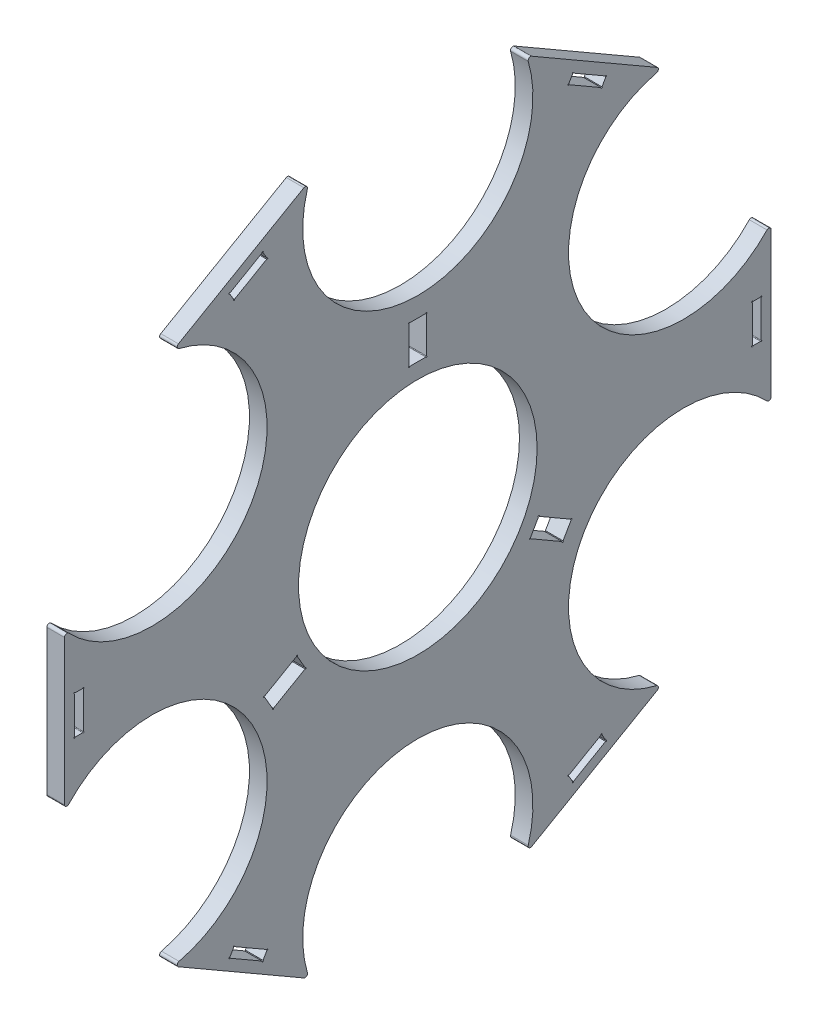
from build123d import *

# Parameters (mm, degrees)
SKETCH2_R           = 39.487475
BOSS_EXTRUDE1_DEPTH = 5.842
FILLET1_R           = 0.79375
SKETCH4_W           = 5.742
SKETCH4_H           = 12.5
CUT_EXTRUDE3_DEPTH  = 163.986308211
SKETCH5_R           = 0.1984375
CUT_EXTRUDE4_DEPTH  = 163.986308211
SKETCH6_W           = 2.975
SKETCH6_H           = 12.7
CUT_EXTRUDE5_DEPTH  = 163.986308211
SKETCH7_R           = 0.1984375
CUT_EXTRUDE6_DEPTH  = 163.986308211


with BuildPart() as part:
    # Sketch2 → Boss-Extrude1 (new body)
    with BuildSketch(Plane(origin=(0, 0, 0), x_dir=(0, 0, -1), z_dir=(1, 0, 0))):
        with BuildLine():
            ThreePointArc((116.947215895, 26.041480267), (54.99261314, 31.75), (81.02619141, 88.258519733))
            Line((81.02619141, 88.258519733), (35.921024484, 114.3))
            ThreePointArc((35.921024484, 114.3), (0, 63.5), (-35.921024484, 114.3))
            Line((-35.921024484, 114.3), (-81.02619141, 88.258519733))
            ThreePointArc((-81.02619141, 88.258519733), (-54.99261314, 31.75), (-116.947215895, 26.041480267))
            Line((-116.947215895, 26.041480267), (-116.947215895, -26.041480267))
            ThreePointArc((-116.947215895, -26.041480267), (-54.99261314, -31.75), (-81.02619141, -88.258519733))
            Line((-81.02619141, -88.258519733), (-35.921024484, -114.3))
            ThreePointArc((-35.921024484, -114.3), (0, -63.5), (35.921024484, -114.3))
            Line((35.921024484, -114.3), (81.02619141, -88.258519733))
            ThreePointArc((81.02619141, -88.258519733), (54.99261314, -31.75), (116.947215895, -26.041480267))
            Line((116.947215895, -26.041480267), (116.947215895, 26.041480267))
        make_face()
        Circle(SKETCH2_R, mode=Mode.SUBTRACT)
    extrude(amount=BOSS_EXTRUDE1_DEPTH)

    # Fillet1
    fillet1_edges = [part.edges().sort_by_distance(p)[0] for p in [
        (2.921, -114.3, 35.921024484),
        (2.921, -114.3, -35.921024484),
        (2.921, -88.258519733, -81.02619141),
        (2.921, -26.041480267, -116.947215895),
        (2.921, 88.258519733, -81.02619141),
        (2.921, 26.041480267, -116.947215895),
        (2.921, -88.258519733, 81.02619141),
        (2.921, -26.041480267, 116.947215895),
        (2.921, 26.041480267, 116.947215895),
        (2.921, 88.258519733, 81.02619141),
        (2.921, 114.3, -35.921024484),
        (2.921, 114.3, 35.921024484),
    ]]
    fillet(fillet1_edges, radius=FILLET1_R)

    # Sketch4 → Cut-Extrude3 (cut, through all)
    with BuildSketch(Plane(origin=(5.842, 0, 0), x_dir=(0, 0, -1), z_dir=(1, 0, 0))):
        Polygon((47.971249286, -31.011358934), (50.842249286, -26.038641066), (40.016931739, -19.788641066), (37.145931739, -24.761358934), align=None)
        with Locations((0, 50.8)):
            Rectangle(SKETCH4_W, SKETCH4_H)
        Polygon((-50.842249286, -26.038641066), (-47.971249286, -31.011358934), (-37.145931739, -24.761358934), (-40.016931739, -19.788641066), align=None)
    extrude(amount=-CUT_EXTRUDE3_DEPTH, mode=Mode.SUBTRACT)

    # Sketch5 → Cut-Extrude4 (cut, through all)
    with BuildSketch(Plane(origin=(5.842, 0, 0), x_dir=(0, 0, -1), z_dir=(1, 0, 0))):
        with Locations((2.871, 57.05)):
            Circle(SKETCH5_R)
        with Locations((-2.871, 57.05)):
            Circle(SKETCH5_R)
        with Locations((-2.871, 44.55)):
            Circle(SKETCH5_R)
        with Locations((2.871, 44.55)):
            Circle(SKETCH5_R)
        with Locations((47.971249286, -31.011358934)):
            Circle(SKETCH5_R)
        with Locations((50.842249286, -26.038641066)):
            Circle(SKETCH5_R)
        with Locations((40.016931739, -19.788641066)):
            Circle(SKETCH5_R)
        with Locations((37.145931739, -24.761358934)):
            Circle(SKETCH5_R)
        with Locations((-50.842249286, -26.038641066)):
            Circle(SKETCH5_R)
        with Locations((-47.971249286, -31.011358934)):
            Circle(SKETCH5_R)
        with Locations((-37.145931739, -24.761358934)):
            Circle(SKETCH5_R)
        with Locations((-40.016931739, -19.788641066)):
            Circle(SKETCH5_R)
    extrude(amount=-CUT_EXTRUDE4_DEPTH, mode=Mode.SUBTRACT)

    # Sketch6 → Cut-Extrude5 (cut, through all)
    with BuildSketch(Plane(origin=(5.842, 0, 0), x_dir=(0, 0, -1), z_dir=(1, 0, 0))):
        Polygon((-49.849346633, 99.041601093), (-60.847869261, 92.691601093), (-62.335369261, 95.268026669), (-51.336846633, 101.618026669), align=None)
        Polygon((60.847869261, 92.691601093), (49.849346633, 99.041601093), (51.336846633, 101.618026669), (62.335369261, 95.268026669), align=None)
        with Locations((112.184715895, 0)):
            Rectangle(SKETCH6_W, SKETCH6_H)
        Polygon((49.849346633, -99.041601093), (60.847869261, -92.691601093), (62.335369261, -95.268026669), (51.336846633, -101.618026669), align=None)
        Polygon((-60.847869261, -92.691601093), (-49.849346633, -99.041601093), (-51.336846633, -101.618026669), (-62.335369261, -95.268026669), align=None)
        with Locations((-112.184715895, 0)):
            Rectangle(SKETCH6_W, SKETCH6_H)
    extrude(amount=-CUT_EXTRUDE5_DEPTH, mode=Mode.SUBTRACT)

    # Sketch7 → Cut-Extrude6 (cut, through all)
    with BuildSketch(Plane(origin=(5.842, 0, 0), x_dir=(0, 0, -1), z_dir=(1, 0, 0))):
        with Locations((-51.336846633, 101.618026669)):
            Circle(SKETCH7_R)
        with Locations((-49.849346633, 99.041601093)):
            Circle(SKETCH7_R)
        with Locations((-60.847869261, 92.691601093)):
            Circle(SKETCH7_R)
        with Locations((-62.335369261, 95.268026669)):
            Circle(SKETCH7_R)
        with Locations((62.335369261, 95.268026669)):
            Circle(SKETCH7_R)
        with Locations((60.847869261, 92.691601093)):
            Circle(SKETCH7_R)
        with Locations((49.849346633, 99.041601093)):
            Circle(SKETCH7_R)
        with Locations((51.336846633, 101.618026669)):
            Circle(SKETCH7_R)
        with Locations((113.672215895, -6.35)):
            Circle(SKETCH7_R)
        with Locations((110.697215895, -6.35)):
            Circle(SKETCH7_R)
        with Locations((110.697215895, 6.35)):
            Circle(SKETCH7_R)
        with Locations((113.672215895, 6.35)):
            Circle(SKETCH7_R)
        with Locations((51.336846633, -101.618026669)):
            Circle(SKETCH7_R)
        with Locations((49.849346633, -99.041601093)):
            Circle(SKETCH7_R)
        with Locations((60.847869261, -92.691601093)):
            Circle(SKETCH7_R)
        with Locations((62.335369261, -95.268026669)):
            Circle(SKETCH7_R)
        with Locations((-62.335369261, -95.268026669)):
            Circle(SKETCH7_R)
        with Locations((-60.847869261, -92.691601093)):
            Circle(SKETCH7_R)
        with Locations((-49.849346633, -99.041601093)):
            Circle(SKETCH7_R)
        with Locations((-51.336846633, -101.618026669)):
            Circle(SKETCH7_R)
        with Locations((-113.672215895, 6.35)):
            Circle(SKETCH7_R)
        with Locations((-110.697215895, 6.35)):
            Circle(SKETCH7_R)
        with Locations((-110.697215895, -6.35)):
            Circle(SKETCH7_R)
        with Locations((-113.672215895, -6.35)):
            Circle(SKETCH7_R)
    extrude(amount=-CUT_EXTRUDE6_DEPTH, mode=Mode.SUBTRACT)


solid = part.part
